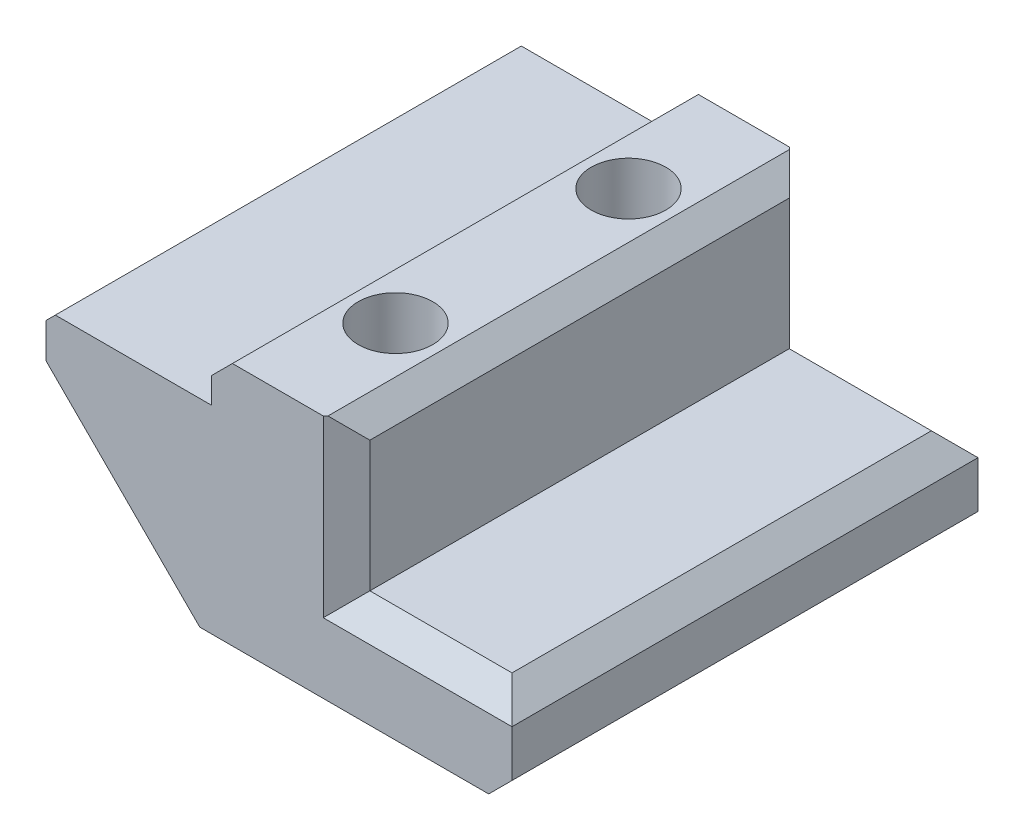
from build123d import *

# Parameters (mm, degrees)
SKETCH_1_W          = 20
SKETCH_1_H          = 20
EXTRUDE_1_DEPTH     = 4
SKETCH_2_W          = 12.9
SKETCH_2_H          = 20
EXTRUDE_2_DEPTH     = 4.5
SKETCH_3_R          = 1.6
CUT_EXTRUDE_1_DEPTH = 30.533878851
SKETCH_4_W          = 5.8
SKETCH_4_H          = 20
SKETCH_4_R          = 1.6
EXTRUDE_3_DEPTH     = 2
SKETCH_5_R          = 3
CUT_EXTRUDE_3_DEPTH = 2.4
CHAMFER_3_SIZE      = 1.5
CHAMFER_1_SIZE      = 6.6
CHAMFER_2_SIZE      = 1
CHAMFER_4_SIZE      = 0.4
CHAMFER_5_SIZE      = 0.9


with BuildPart() as part:
    # 草图1 → 凸台-拉伸1 (new body)
    with BuildSketch(Plane(origin=(0, 0, 0), x_dir=(1, 0, 0), z_dir=(0, 1, 0))):
        with Locations((10, 10)):
            Rectangle(SKETCH_1_W, SKETCH_1_H)
    extrude(amount=EXTRUDE_1_DEPTH)

    # 草图2 → 凸台-拉伸2 (add)
    with BuildSketch(Plane(origin=(0, 4, 0), x_dir=(1, 0, 0), z_dir=(0, 1, 0))):
        with Locations((6.45, 10)):
            Rectangle(SKETCH_2_W, SKETCH_2_H)
    extrude(amount=EXTRUDE_2_DEPTH)

    # 草图3 → 切除-拉伸1 (cut, through all)
    with BuildSketch(Plane(origin=(0, 0, 0), x_dir=(-1, 0, 0), z_dir=(0, -1, 0))):
        with Locations(Location((-10, 5, 0), (0, 0, 90))):
            Circle(SKETCH_3_R)
        with Locations(Location((-10, 15, 0), (0, 0, 90))):
            Circle(SKETCH_3_R)
    extrude(amount=-CUT_EXTRUDE_1_DEPTH, mode=Mode.SUBTRACT)

    # 草图4 → 凸台-拉伸3 (add)
    with BuildSketch(Plane(origin=(0, 8.5, 0), x_dir=(1, 0, 0), z_dir=(0, 1, 0))):
        with Locations((10, 10)):
            Rectangle(SKETCH_4_W, SKETCH_4_H)
        with Locations(Location((10, 15, 0), (0, 0, 90))):
            Circle(SKETCH_4_R, mode=Mode.SUBTRACT)
        with Locations(Location((10, 5, 0), (0, 0, 90))):
            Circle(SKETCH_4_R, mode=Mode.SUBTRACT)
    extrude(amount=EXTRUDE_3_DEPTH)

    # 草图5 → 切除-拉伸3 (cut)
    with BuildSketch(Plane(origin=(0, 0, 0), x_dir=(-1, 0, 0), z_dir=(0, -1, 0))):
        with Locations(Location((-10, 5, 0), (0, 0, 90))):
            Circle(SKETCH_5_R)
        with Locations(Location((-10, 15, 0), (0, 0, 90))):
            Circle(SKETCH_5_R)
    extrude(amount=-CUT_EXTRUDE_3_DEPTH, mode=Mode.SUBTRACT)

    # 倒角3
    # the kernel refuses this chamfer: 1.5 mm, written as the material it takes off along each edge
    with BuildSketch(Plane(origin=(10, 2.4, -15), x_dir=(0, 0, -1), z_dir=(-1, 0, 0))) as chamfer_3_piece_1_section:
        Polygon((1.6 + CHAMFER_3_SIZE, 0), (1.6, -CHAMFER_3_SIZE), (1.6, 0), align=None)
    chamfer_3_piece_1 = revolve(axis=Axis((10, 2.4, -15), (0, -1, 0)), mode=Mode.PRIVATE)
    chamfer_3_piece_1 = chamfer_3_piece_1 & Plane(origin=(10, 3.20338318, -15), x_dir=(0, 0, -1), z_dir=(0, -1, 0)) * Cylinder(3, 13, mode=Mode.PRIVATE)
    add(chamfer_3_piece_1, mode=Mode.SUBTRACT)
    with BuildSketch(Plane(origin=(10, 2.4, -5), x_dir=(0, 0, -1), z_dir=(-1, 0, 0))) as chamfer_3_piece_2_section:
        Polygon((1.6 + CHAMFER_3_SIZE, 0), (1.6, -CHAMFER_3_SIZE), (1.6, 0), align=None)
    chamfer_3_piece_2 = revolve(axis=Axis((10, 2.4, -5), (0, -1, 0)), mode=Mode.PRIVATE)
    chamfer_3_piece_2 = chamfer_3_piece_2 & Plane(origin=(10, 3.20338318, -5), x_dir=(0, 0, -1), z_dir=(0, -1, 0)) * Cylinder(3, 13, mode=Mode.PRIVATE)
    add(chamfer_3_piece_2, mode=Mode.SUBTRACT)

    # 倒角1
    chamfer_1_edges = [part.edges().sort_by_distance(p)[0] for p in [
        (0, 0, -10),
    ]]
    chamfer(chamfer_1_edges, length=CHAMFER_1_SIZE)

    # 倒角2
    chamfer_2_edges = [part.edges().sort_by_distance(p)[0] for p in [
        (20, 4, -10),
        (16.45, 4, 0),
        (12.9, 7.25, 0),
        (12.9, 7.25, -20),
        (16.45, 4, -20),
        (20, 0, -10),
    ]]
    chamfer(chamfer_2_edges, length=CHAMFER_2_SIZE)

    # 倒角4
    chamfer_4_edges = [part.edges().sort_by_distance(p)[0] for p in [
        (0, 8.5, -10),
    ]]
    chamfer(chamfer_4_edges, length=CHAMFER_4_SIZE)

    # 倒角5
    chamfer_5_edges = [part.edges().sort_by_distance(p)[0] for p in [
        (7.1, 10.5, -10),
        (12.9, 10.5, -10),
    ]]
    chamfer(chamfer_5_edges, length=CHAMFER_5_SIZE)


solid = part.part
